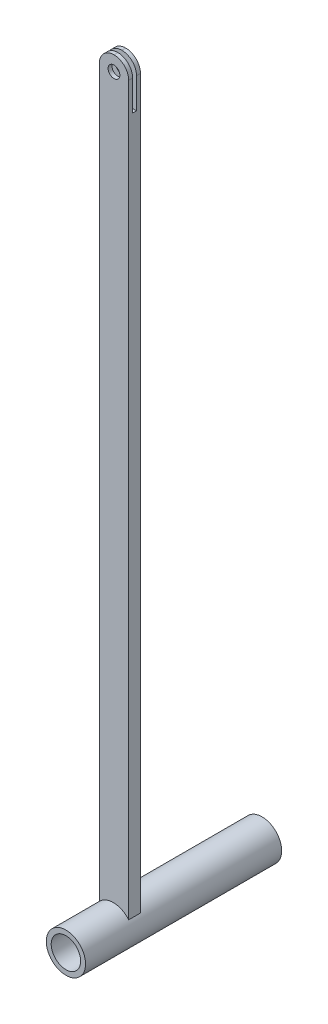
from build123d import *

# Parameters (mm, degrees)
SKETCH_1_R           = 10
SKETCH_1_R_2         = 7.5
EXTRUDE_1_DEPTH      = 50
EXTRUDE_2_REACH      = 399.792
EXTRUDE_2_END_RADIUS = 10
SKETCH_2_W           = 15
SKETCH_2_H           = 6
FILLET_1_R           = 7.5
SKETCH_3_R           = 3
CUT_EXTRUDE_1_DEPTH  = 10
SKETCH_4_W           = 2
SKETCH_4_H           = 23
CUT_EXTRUDE_2_DEPTH  = 20


with BuildPart() as part:
    # 草图1 → 凸台-拉伸1 (new, symmetric)
    with BuildSketch(Plane.XY):
        Circle(SKETCH_1_R)
        Circle(SKETCH_1_R_2, mode=Mode.SUBTRACT)
    extrude(amount=EXTRUDE_1_DEPTH, both=True)

    # 凸台-拉伸2: up to this cylinder (the profile starts outside it)
    extrude_2_end = Plane(origin=(0, 0, 22.779793), z_dir=(0, 0, -1)) * Cylinder(EXTRUDE_2_END_RADIUS, 820.584, mode=Mode.PRIVATE)
    # 草图2 → 凸台-拉伸2 (add, up to the surface)
    with BuildSketch(Plane(origin=(0, 384.51, 0), x_dir=(1, 0, 0), z_dir=(0, 1, 0)), mode=Mode.PRIVATE) as extrude_2_sk1:
        with Locations((0.280971345, -22.779792891)):
            Rectangle(SKETCH_2_W, SKETCH_2_H)
    extrude_2_tool1 = extrude(extrude_2_sk1.sketch, amount=-EXTRUDE_2_REACH, mode=Mode.PRIVATE) - extrude_2_end
    add(extrude_2_tool1.solids().sort_by_distance((0.280971, 384.51, 22.779793))[0])

    # 圆角1
    fillet_1_edges = [part.edges().sort_by_distance(p)[0] for p in [
        (7.780971345, 384.51, 22.779792891),
        (-7.219028655, 384.51, 22.779792891),
    ]]
    fillet(fillet_1_edges, radius=FILLET_1_R - 0.0001)  # a hair under: the kernel refuses the full size

    # 草图3 → 切除-拉伸1 (cut)
    with BuildSketch(Plane(origin=(0, 0, 19.779792891), x_dir=(-1, 0, 0), z_dir=(0, 0, -1))):
        with Locations((-0.280971345, 377.01)):
            Circle(SKETCH_3_R)
    extrude(amount=-CUT_EXTRUDE_1_DEPTH, mode=Mode.SUBTRACT)

    # 草图4 → 切除-拉伸2 (cut)
    with BuildSketch(Plane.ZY.offset(7.219028655)):
        with Locations((22.779792891, 373.01)):
            Rectangle(SKETCH_4_W, SKETCH_4_H)
    extrude(amount=-CUT_EXTRUDE_2_DEPTH, mode=Mode.SUBTRACT)


solid = part.part
